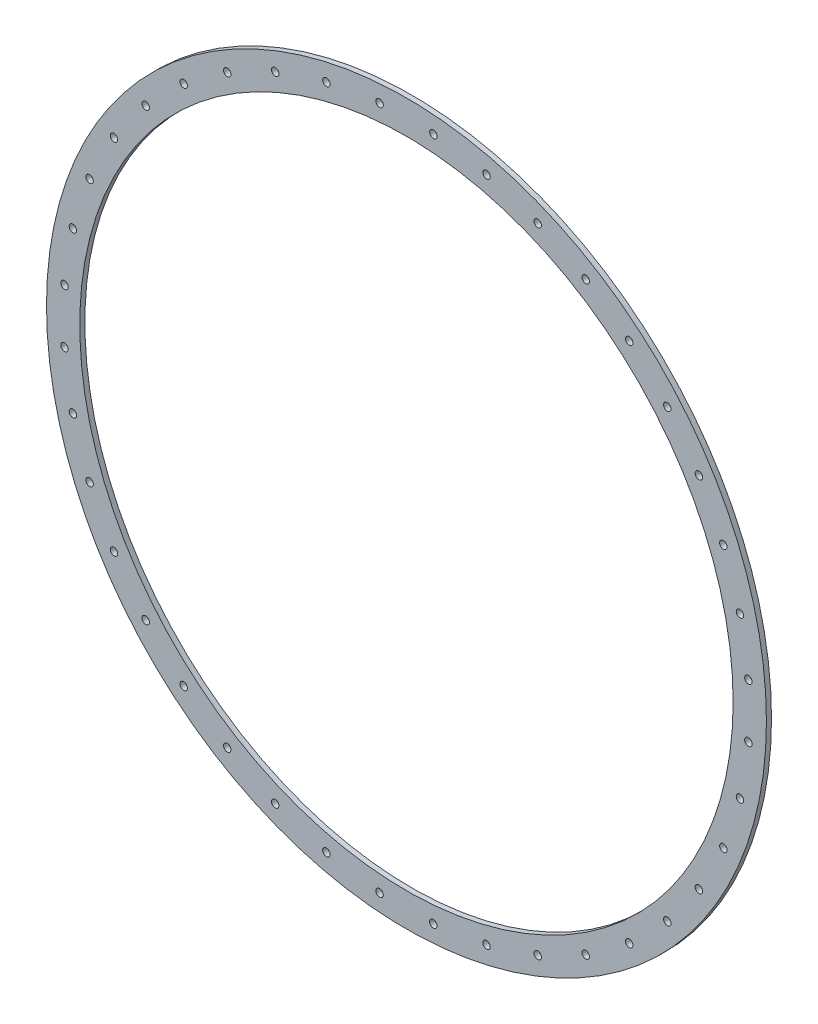
from build123d import *

# Parameters (mm, degrees)
SKETCH1_R          = 1060
SKETCH1_R_2        = 962
BASE_FLANGE1_DEPTH = 15
SKETCH2_R          = 11
CUT_EXTRUDE1_DEPTH = 20
CIRPATTERN1_COUNT  = 40


# Sheet-metal steps are written as plain solids
with BuildPart() as part:
    # Sketch1 → Base-Flange1 (new body)
    with BuildSketch(Plane.XY):
        Circle(SKETCH1_R)
        Circle(SKETCH1_R_2, mode=Mode.SUBTRACT)
    extrude(amount=-BASE_FLANGE1_DEPTH)

    # Sketch2 → Cut-Extrude1 (cut)
    with BuildSketch(Plane.XY):
        with Locations((79.243686685, 1006.88650707)):
            Circle(SKETCH2_R)
    cut_extrude1 = extrude(amount=-CUT_EXTRUDE1_DEPTH, mode=Mode.SUBTRACT)

    # CirPattern1: Cut-Extrude1 ×40 about axis
    cirpattern1_axis = Axis((0, 0, 0), (0, 0, 1))
    for i in range(1, CIRPATTERN1_COUNT):
        add(cut_extrude1.rotate(cirpattern1_axis, i * 360 / CIRPATTERN1_COUNT), mode=Mode.SUBTRACT)


solid = part.part
